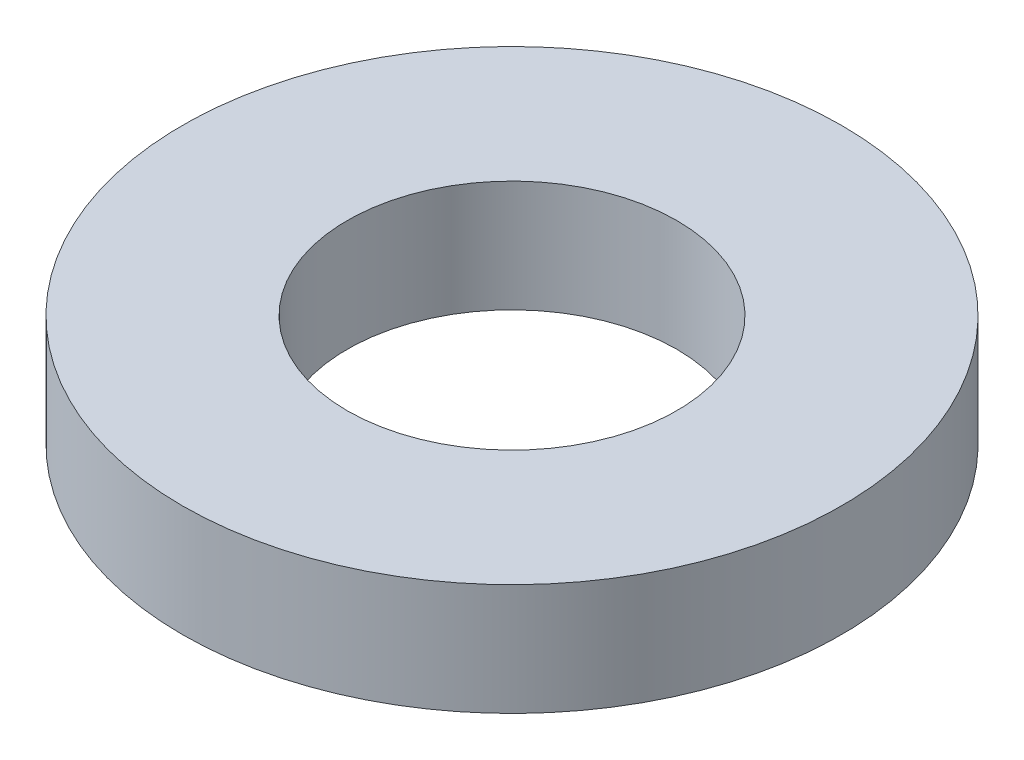
from build123d import *

# Parameters (mm, degrees)
SKETCH1_R           = 65
BOSS_EXTRUDE1_DEPTH = 22
SKETCH2_R           = 32.5
CUT_EXTRUDE1_DEPTH  = 95.519839187


with BuildPart() as part:
    # Sketch1 → Boss-Extrude1 (new body)
    with BuildSketch(Plane(origin=(0, 0, 0), x_dir=(1, 0, 0), z_dir=(0, 1, 0))):
        Circle(SKETCH1_R)
    extrude(amount=BOSS_EXTRUDE1_DEPTH)

    # Sketch2 → Cut-Extrude1 (cut, through all)
    with BuildSketch(Plane(origin=(0, 0, 0), x_dir=(1, 0, 0), z_dir=(0, 1, 0))):
        Circle(SKETCH2_R)
    extrude(amount=CUT_EXTRUDE1_DEPTH, mode=Mode.SUBTRACT)


solid = part.part
